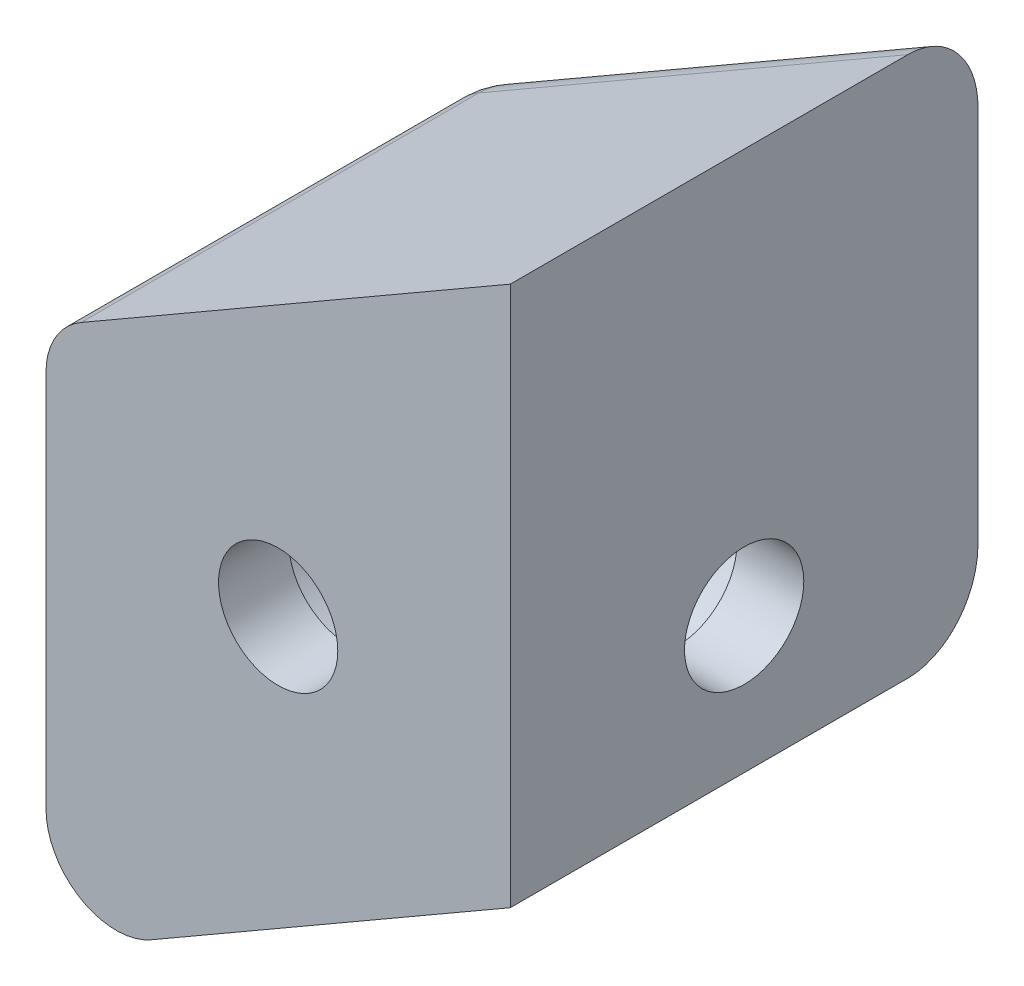
from build123d import *

# Parameters (mm, degrees)
BOSS_EXTRUDE1_DEPTH     = 20
SKETCH4_R               = 2.55
CUT_EXTRUDE2_DEPTH      = 34.212108316
CUT_EXTRUDE3_DEPTH      = 34.212108316
CUT_EXTRUDE3_DEPTH_BACK = 34.212108316
SKETCH5_R               = 2.55
SKETCH6_R               = 5.3
CUT_EXTRUDE4_DEPTH      = 17
CUT_EXTRUDE5_DEPTH      = 7
CUT_EXTRUDE5_DEPTH_BACK = 10
SKETCH7_R               = 5.3
FILLET1_R               = 0.7
FILLET2_R               = 3


with BuildPart() as part:
    # Sketch1 → Boss-Extrude1 (new body)
    with BuildSketch(Plane.XY):
        Polygon((-10, 13.094), (9.854423989, 24.556957035), (9.854423989, 1.462957035), (-10, -10), align=None)
    extrude(amount=BOSS_EXTRUDE1_DEPTH)

    # Sketch4 → Cut-Extrude2 (cut, through all)
    with BuildSketch(Plane.XY):
        with Locations((-0.072788005, 7.278478517)):
            Circle(SKETCH4_R)
    extrude(amount=CUT_EXTRUDE2_DEPTH, mode=Mode.SUBTRACT)

    # Sketch5 → Cut-Extrude3 (cut, two sides: drawn at the far end of the back side and taken through both)
    with BuildSketch(Plane(origin=(0, 0, 0), x_dir=(0, 0, -1), z_dir=(1, 0, 0)).offset(-CUT_EXTRUDE3_DEPTH_BACK)):
        with Locations((-10, 7.278478517)):
            Circle(SKETCH5_R)
    extrude(amount=CUT_EXTRUDE3_DEPTH + CUT_EXTRUDE3_DEPTH_BACK, mode=Mode.SUBTRACT)

    # Sketch6 → Cut-Extrude4 (cut)
    with BuildSketch(Plane.XY):
        with Locations((-0.072788005, 7.278478517)):
            Circle(SKETCH6_R)
    extrude(amount=CUT_EXTRUDE4_DEPTH, mode=Mode.SUBTRACT)

    # Sketch7 → Cut-Extrude5 (cut, two sides: drawn at the far end of the back side and taken through both)
    with BuildSketch(Plane(origin=(0, 0, 0), x_dir=(0, 0, -1), z_dir=(1, 0, 0)).offset(-CUT_EXTRUDE5_DEPTH_BACK)):
        with Locations(Location((-10, 7.278478517, 0), (0, 0, 90))):
            Circle(SKETCH7_R)
    extrude(amount=CUT_EXTRUDE5_DEPTH + CUT_EXTRUDE5_DEPTH_BACK, mode=Mode.SUBTRACT)

    # Fillet1
    fillet1_edges = [part.edges().sort_by_distance(p)[0] for p in [
        (-5.372788005, 7.278478517, 17),
        (7, 1.978478517, 10),
    ]]
    fillet(fillet1_edges, radius=FILLET1_R)

    # Fillet2
    # the kernel refuses this fillet: 3 mm, written as the material it takes off along each edge
    with BuildSketch(Plane(origin=(-7, -4.803847577, 3), x_dir=(-1, 0, 0), z_dir=(0, 0, -1))) as fillet2_piece_1_section:
        Polygon((0, 0), (FILLET2_R, 0), (FILLET2_R, -FILLET2_R * 1.73205080757), (-FILLET2_R * 0.5, -FILLET2_R * 0.866025403784), align=None)
    fillet2_piece_1 = extrude(amount=FILLET2_R, mode=Mode.PRIVATE)
    fillet2_piece_1 = fillet2_piece_1 - Plane(origin=(-7, -4.803847577, 3), x_dir=(0.49999999999999906, 0.8660254037844392, 0), z_dir=(0, 0, -1)) * Sphere(FILLET2_R, mode=Mode.PRIVATE)
    add(fillet2_piece_1, mode=Mode.SUBTRACT)
    with BuildSketch(Plane(origin=(-7, 11.361949192, 3), x_dir=(-0.5000000000000018, 0.8660254037844377, 0), z_dir=(0, 0, -1))) as fillet2_piece_2_section:
        Polygon((0, 0), (FILLET2_R, 0), (FILLET2_R, -FILLET2_R * 0.57735026919), (FILLET2_R * 0.5, -FILLET2_R * 0.866025403784), align=None)
    fillet2_piece_2 = extrude(amount=FILLET2_R, mode=Mode.PRIVATE)
    fillet2_piece_2 = fillet2_piece_2 - Plane(origin=(-7, 11.361949192, 3), x_dir=(0.8660254037844393, -0.49999999999999883, 0), z_dir=(0, 0, -1)) * Sphere(FILLET2_R, mode=Mode.PRIVATE)
    add(fillet2_piece_2, mode=Mode.SUBTRACT)
    with BuildSketch(Plane(origin=(-10, -4.803847577, 0), x_dir=(0, 0, 1), z_dir=(0, 1, 0))) as fillet2_piece_3:
        with BuildLine():
            CenterArc((FILLET2_R, FILLET2_R), FILLET2_R, 180, 90)
            Line((0, FILLET2_R), (0, 0))
            Line((0, 0), (FILLET2_R, 0))
        make_face()
    extrude(amount=16.16579677, mode=Mode.SUBTRACT)
    with BuildSketch(Plane(origin=(-8.5, 13.960025404, 0), x_dir=(0, 0, 1), z_dir=(0.8660254037844377, 0.5000000000000018, 0))) as fillet2_piece_4:
        with BuildLine():
            CenterArc((FILLET2_R, FILLET2_R), FILLET2_R, 180, 90)
            Line((0, FILLET2_R), (0, 0))
            Line((0, 0), (FILLET2_R, 0))
        make_face()
    extrude(amount=28.693863262, mode=Mode.SUBTRACT)
    with BuildSketch(Plane(origin=(16.349614518, 5.212957035, 0), x_dir=(0, 0, 1), z_dir=(-0.866025403784438, -0.5000000000000012, 0))) as fillet2_piece_5:
        with BuildLine():
            CenterArc((FILLET2_R, FILLET2_R), FILLET2_R, 180, 90)
            Line((0, FILLET2_R), (0, 0))
            Line((0, 0), (FILLET2_R, 0))
        make_face()
    extrude(amount=25.229761647, mode=Mode.SUBTRACT)
    with BuildSketch(Plane(origin=(-10, -10, 3), x_dir=(0, 1, 0), z_dir=(0, 0, 1))) as fillet2_piece_6:
        with BuildLine():
            CenterArc((FILLET2_R * 1.73205080757, -FILLET2_R), FILLET2_R, 90, 120)
            Line((FILLET2_R * 0.866025403784, -FILLET2_R * 1.5), (0, 0))
            Line((0, 0), (FILLET2_R * 1.73205080757, 0))
        make_face()
    extrude(amount=29.990381057, mode=Mode.SUBTRACT)
    with BuildSketch(Plane(origin=(-10, 13.094, 3), x_dir=(0.8660254037844375, 0.5000000000000019, 0), z_dir=(0, 0, 1))) as fillet2_piece_7:
        with BuildLine():
            CenterArc((FILLET2_R * 0.57735026919, -FILLET2_R), FILLET2_R, 90, 60)
            Line((-FILLET2_R * 0.288675134595, -FILLET2_R * 0.5), (0, 0))
            Line((0, 0), (FILLET2_R * 0.57735026919, 0))
        make_face()
    extrude(amount=21.330127019, mode=Mode.SUBTRACT)


solid = part.part
